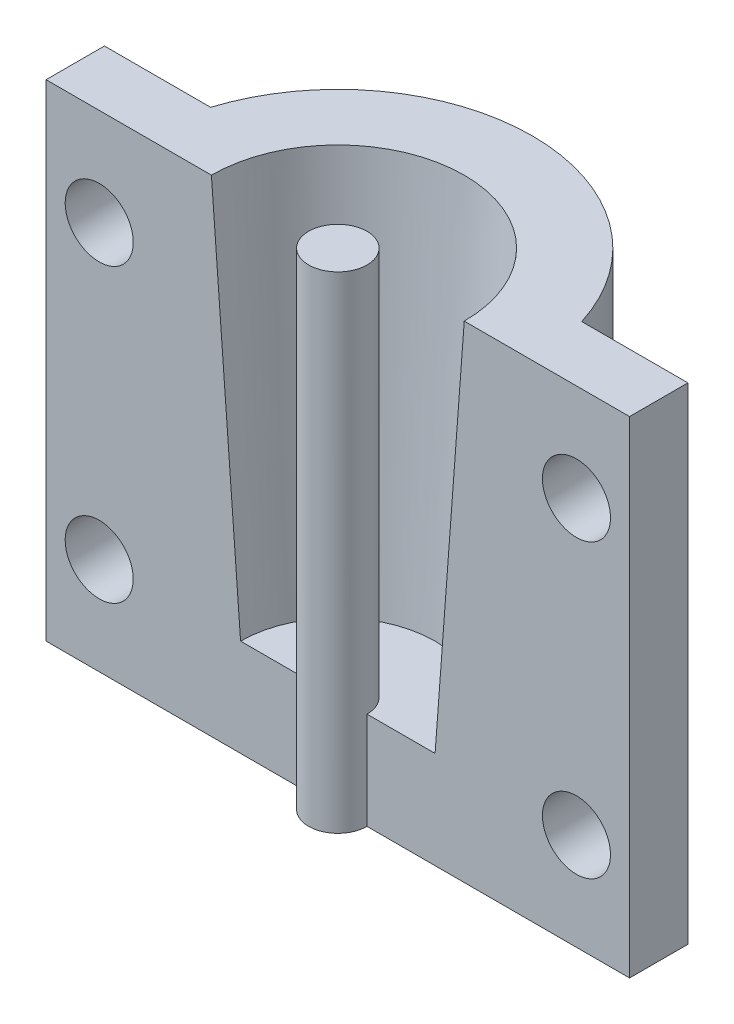
from build123d import *

# Parameters (mm, degrees)
SKETCH1_R           = 10
BOSS_EXTRUDE1_DEPTH = 25
SKETCH4_R           = 1.5
BOSS_EXTRUDE2_DEPTH = 20
SKETCH6_W           = 7.254775406
SKETCH6_H           = 3
BOSS_EXTRUDE3_DEPTH = 25
CUT_EXTRUDE1_DEPTH  = 31.822070015
SKETCH7_R           = 1.75
CUT_EXTRUDE2_DEPTH  = 30.983328701


# Read off the part's stored shape, not the designer's step: Boundary-Cut1
with BuildPart() as part:
    # Sketch1 → Boss-Extrude1 (new body)
    with BuildSketch(Plane(origin=(0, 0, 0), x_dir=(1, 0, 0), z_dir=(0, 1, 0))):
        with Locations(Location((0, 0, 0), (0, 0, 270))):
            Circle(SKETCH1_R)
    extrude(amount=BOSS_EXTRUDE1_DEPTH)

    # Boundary-Cut1 outline → Boundary-Cut1 (revolve, cut)
    with BuildSketch(Plane.XY):
        Polygon((0, 5), (5, 5), (6.5, 25), (0, 25), align=None)
    revolve(axis=Axis((0, 0, 0), (0, 1, 0)), mode=Mode.SUBTRACT)

    # Sketch4 → Boss-Extrude2 (add)
    with BuildSketch(Plane(origin=(0, 5, 0), x_dir=(1, 0, 0), z_dir=(0, 1, 0))):
        with Locations(Location((0, 0, 0), (0, 0, 90))):
            Circle(SKETCH4_R)
    extrude(amount=BOSS_EXTRUDE2_DEPTH)

    # Sketch6 → Boss-Extrude3 (add)
    with BuildSketch(Plane(origin=(0, 0, 0), x_dir=(1, 0, 0), z_dir=(0, 1, 0))):
        with Locations((-11.372612297, 1.5)):
            Rectangle(SKETCH6_W, SKETCH6_H)
    boss_extrude3 = extrude(amount=BOSS_EXTRUDE3_DEPTH)

    # Sketch5 → Cut-Extrude1 (cut, through all)
    with BuildSketch(Plane(origin=(0, 25, 0), x_dir=(1, 0, 0), z_dir=(0, 1, 0))):
        with BuildLine():
            Line((-1.5, 0), (-10, 0))
            ThreePointArc((-10, 0), (0, -10), (10, 0))
            Line((10, 0), (1.5, 0))
            ThreePointArc((1.5, 0), (0, -1.5), (-1.5, 0))
        make_face()
    extrude(amount=-CUT_EXTRUDE1_DEPTH, mode=Mode.SUBTRACT)

    # Sketch7 → Cut-Extrude2 (cut, through all)
    with BuildSketch(Plane(origin=(0, 0, -3), x_dir=(-1, 0, 0), z_dir=(0, 0, -1))):
        with Locations((12.269696007, 5)):
            Circle(SKETCH7_R)
        with Locations((12.269696007, 20)):
            Circle(SKETCH7_R)
    cut_extrude2 = extrude(amount=-CUT_EXTRUDE2_DEPTH, mode=Mode.SUBTRACT)

    # Mirror1: Boss-Extrude3, Cut-Extrude2 across plane
    add(boss_extrude3.mirror(Plane(origin=(0, 0, 0), x_dir=(0, 0, 1), z_dir=(1, 0, 0))))
    add(cut_extrude2.mirror(Plane(origin=(0, 0, 0), x_dir=(0, 0, 1), z_dir=(1, 0, 0))), mode=Mode.SUBTRACT)


solid = part.part
